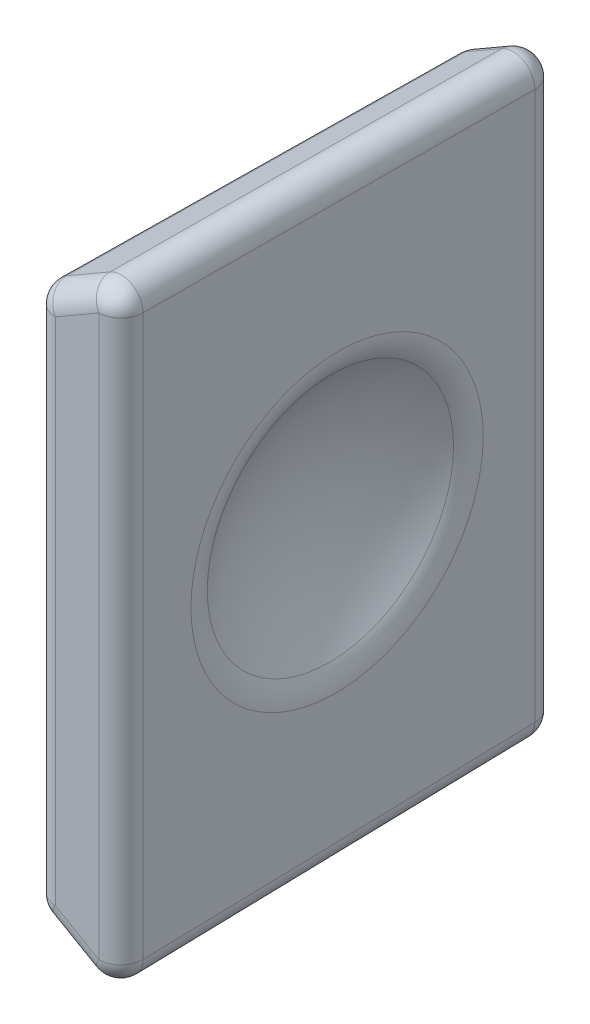
from build123d import *

# Parameters (mm, degrees)
BOSS_EXTRUDE1_DEPTH = 20
BOSS_EXTRUDE1_DRAFT = -0.5
FILLET1_R           = 1
FILLET2_R           = 2


with BuildPart() as part:
    # Sketch1 → Boss-Extrude1 (with draft: the straight prism first)
    with BuildSketch(Plane.XY):
        Polygon((0, 14.5), (-4, 12.190598923), (-4, -12.190598923), (0, -14.5), align=None)
    extrude(amount=-BOSS_EXTRUDE1_DEPTH)
    # Boss-Extrude1: the draft: its side faces are tilted about the plane it starts from
    boss_extrude1_sides = [part.faces().sort_by_distance(p)[0] for p in [
        (-2, -13.345299462, -10),
        (0, 0, -10),
        (-2, 13.345299462, -10),
        (-4, 0, -10),
    ]]
    draft(boss_extrude1_sides, Plane.XY, BOSS_EXTRUDE1_DRAFT)

    # Fillet1
    fillet1_edges = [part.edges().sort_by_distance(p)[0] for p in [
        (-0.087268678, 14.348846216, -10),
        (-0.087268678, -14.348846216, -10),
        (-3.912731322, -12.140214329, -10),
        (-3.912731322, 12.140214329, -10),
        (-3.825462644, 0, -20),
        (-0.174537356, 0, -20),
        (-2, -13.143761083, -20),
        (-4, 0, 0),
        (0, 0, 0),
        (-2, -13.345299462, 0),
        (-2, 13.143761083, -20),
        (-2, 13.345299462, 0),
    ]]
    fillet(fillet1_edges, radius=FILLET1_R)

    # Sketch2 → Cut-Revolve1 (revolve, cut)
    with BuildSketch(Plane(origin=(0, 0, 0), x_dir=(1, 0, 0), z_dir=(0, 1, 0))):
        with BuildLine():
            Line((8.726833455, 10.000724303), (8.726833455, -0.726109151))
            ThreePointArc((8.726833455, -0.726109151), (16.311850131, 2.415707627), (19.453666909, 10.000724303))
            ThreePointArc((19.453666909, 10.000724303), (16.311850131, 17.58574098), (8.726833455, 20.727557758))
            Line((8.726833455, 20.727557758), (8.726833455, 10.000724303))
        make_face()
    revolve(axis=Axis((8.726833455, 0, -20.727557758), (0, 0, 1)), mode=Mode.SUBTRACT)

    # Fillet2
    fillet2_edges = [part.edges().sort_by_distance(p)[0] for p in [
        (-0.139958798, 0, -16.037689693),
    ]]
    fillet(fillet2_edges, radius=FILLET2_R)


solid = part.part
